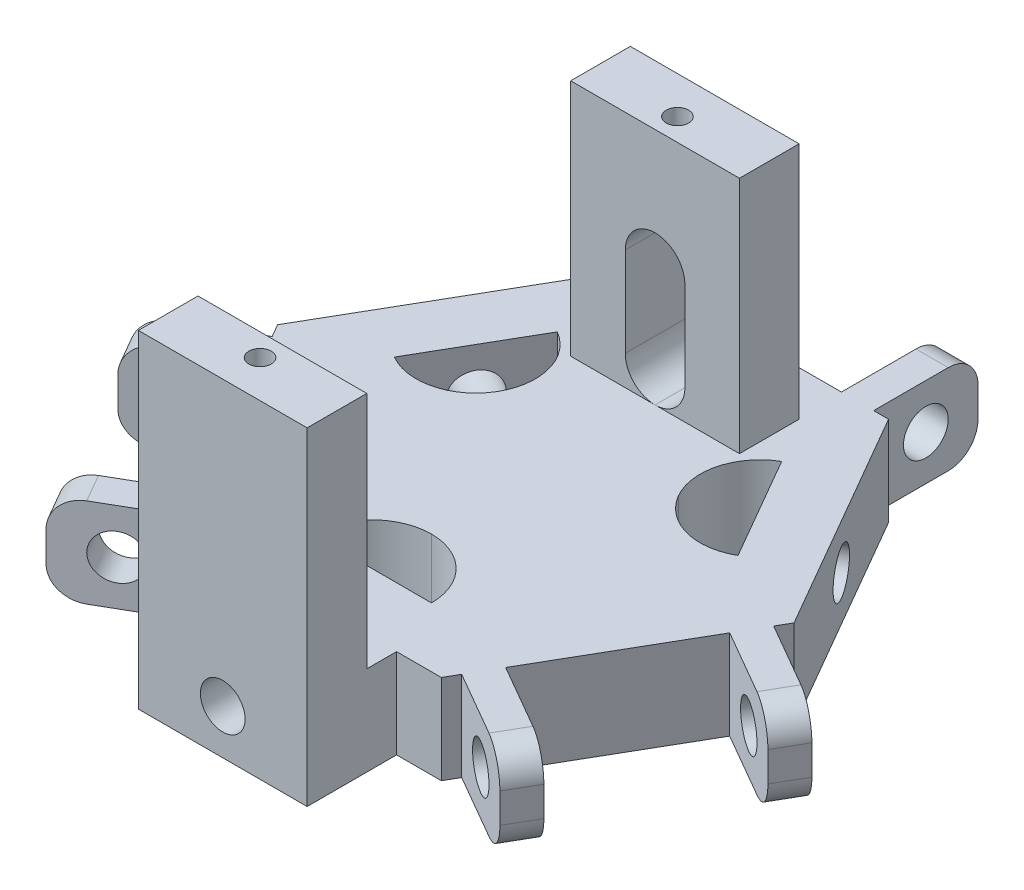
from build123d import *

# Parameters (mm, degrees)
BOSS_EXTRUDE1_DEPTH = 6
SKETCH2_W           = 2.16
SKETCH2_H           = 6
BOSS_EXTRUDE2_DEPTH = 7
SKETCH4_W           = 2.16
SKETCH4_H           = 6
BOSS_EXTRUDE3_DEPTH = 7
SKETCH5_W           = 2.16
SKETCH5_H           = 6
BOSS_EXTRUDE4_DEPTH = 7
SKETCH6_W           = 2.16
SKETCH6_H           = 6
BOSS_EXTRUDE5_DEPTH = 7
SKETCH7_W           = 2.16
SKETCH7_H           = 6
BOSS_EXTRUDE6_DEPTH = 7
SKETCH9_W           = 2.16
SKETCH9_H           = 6
BOSS_EXTRUDE7_DEPTH = 7
SKETCH11_W          = 11.320508076
SKETCH11_H          = 22
BOSS_EXTRUDE8_DEPTH = 6
SKETCH13_W          = 11.320508076
SKETCH13_H          = 2
CUT_EXTRUDE1_DEPTH  = 16
SKETCH14_W          = 11.320508076
SKETCH14_H          = 4
BOSS_EXTRUDE9_DEPTH = 16
SKETCH22_W          = 4
SKETCH22_H          = 10
CUT_EXTRUDE8_DEPTH  = 4
SKETCH23_R          = 1.5
CUT_EXTRUDE9_DEPTH  = 44.598981412
SKETCH24_R          = 1.5
CUT_EXTRUDE10_DEPTH = 45.916354208
SKETCH25_R          = 1.5
CUT_EXTRUDE11_DEPTH = 45.285561147
SKETCH26_W          = 8
SKETCH26_H          = 4
CUT_EXTRUDE12_DEPTH = 6
FILLET1_R           = 4
CUT_EXTRUDE13_DEPTH = 6
FILLET2_R           = 4
CUT_EXTRUDE14_DEPTH = 6
FILLET3_R           = 4
SKETCH34_R          = 1.5
CUT_EXTRUDE15_DEPTH = 4
SKETCH35_R          = 1.5
CUT_EXTRUDE16_DEPTH = 4
SKETCH36_R          = 1.5
CUT_EXTRUDE17_DEPTH = 10
FILLET4_R           = 2
FILLET5_R           = 2
SKETCH37_R          = 0.75
CUT_EXTRUDE19_DEPTH = 5
SKETCH39_R          = 0.75
CUT_EXTRUDE20_DEPTH = 5
FILLET6_R           = 2


with BuildPart() as part:
    # Sketch1 → Boss-Extrude1 (new body)
    with BuildSketch(Plane(origin=(0, 0, 0), x_dir=(1, 0, 0), z_dir=(0, 1, 0))):
        Polygon((17.320508076, 0), (8.660254038, 15), (-8.660254038, 15), (-17.320508076, 0), (-8.660254038, -15), (8.660254038, -15), align=None)
    extrude(amount=BOSS_EXTRUDE1_DEPTH)

    # Sketch2 → Boss-Extrude2 (add)
    with BuildSketch(Plane(origin=(12.990381057, 0, 7.5), x_dir=(0.4999999999999997, 0, -0.8660254037844388), z_dir=(0.8660254037844389, 0, 0.49999999999999983))):
        with Locations((-6.580254038, 3)):
            Rectangle(SKETCH2_W, SKETCH2_H)
    extrude(amount=BOSS_EXTRUDE2_DEPTH)

    # Sketch4 → Boss-Extrude3 (add)
    with BuildSketch(Plane(origin=(12.990381057, 0, 7.5), x_dir=(0.4999999999999997, 0, -0.8660254037844388), z_dir=(0.8660254037844389, 0, 0.49999999999999983))):
        with Locations((6.580254038, 3)):
            Rectangle(SKETCH4_W, SKETCH4_H)
    extrude(amount=BOSS_EXTRUDE3_DEPTH)

    # Sketch5 → Boss-Extrude4 (add)
    with BuildSketch(Plane(origin=(-12.990381057, 0, 7.5), x_dir=(0.4999999999999999, 0, 0.8660254037844387), z_dir=(-0.8660254037844388, 0, 0.49999999999999994))):
        with Locations((-6.580254038, 3)):
            Rectangle(SKETCH5_W, SKETCH5_H)
    extrude(amount=BOSS_EXTRUDE4_DEPTH)

    # Sketch6 → Boss-Extrude5 (add)
    with BuildSketch(Plane(origin=(-12.990381057, 0, 7.5), x_dir=(0.4999999999999999, 0, 0.8660254037844387), z_dir=(-0.8660254037844388, 0, 0.49999999999999994))):
        with Locations((6.580254038, 3)):
            Rectangle(SKETCH6_W, SKETCH6_H)
    extrude(amount=BOSS_EXTRUDE5_DEPTH)

    # Sketch7 → Boss-Extrude6 (add)
    with BuildSketch(Plane(origin=(0, 0, -15), x_dir=(-1, 0, 0), z_dir=(0, 0, -1))):
        with Locations((-6.580254038, 3)):
            Rectangle(SKETCH7_W, SKETCH7_H)
    extrude(amount=BOSS_EXTRUDE6_DEPTH)

    # Sketch9 → Boss-Extrude7 (add)
    with BuildSketch(Plane(origin=(0, 0, -15), x_dir=(-1, 0, 0), z_dir=(0, 0, -1))):
        with Locations((6.580254038, 3)):
            Rectangle(SKETCH9_W, SKETCH9_H)
    extrude(amount=BOSS_EXTRUDE7_DEPTH)

    # Sketch11 → Boss-Extrude8 (add)
    with BuildSketch(Plane.XY.offset(15)):
        with Locations((0, 11)):
            Rectangle(SKETCH11_W, SKETCH11_H)
    extrude(amount=BOSS_EXTRUDE8_DEPTH)

    # Sketch13 → Cut-Extrude1 (cut)
    with BuildSketch(Plane(origin=(0, 22, 0), x_dir=(1, 0, 0), z_dir=(0, 1, 0))):
        with Locations((0, -16)):
            Rectangle(SKETCH13_W, SKETCH13_H)
    extrude(amount=-CUT_EXTRUDE1_DEPTH, mode=Mode.SUBTRACT)

    # Sketch14 → Boss-Extrude9 (add)
    with BuildSketch(Plane(origin=(0, 6, 0), x_dir=(1, 0, 0), z_dir=(0, 1, 0))):
        with Locations((0, 10)):
            Rectangle(SKETCH14_W, SKETCH14_H)
    extrude(amount=BOSS_EXTRUDE9_DEPTH)

    # Sketch22 → Cut-Extrude8 (cut)
    with BuildSketch(Plane(origin=(0, 0, -12), x_dir=(-1, 0, 0), z_dir=(0, 0, -1))):
        with Locations((0.000254038, 11)):
            Rectangle(SKETCH22_W, SKETCH22_H)
    extrude(amount=-CUT_EXTRUDE8_DEPTH, mode=Mode.SUBTRACT)

    # Sketch23 → Cut-Extrude9 (cut, through all)
    with BuildSketch(Plane(origin=(7.660254038, 0, 0), x_dir=(0, 0, -1), z_dir=(1, 0, 0))):
        with Locations(Location((18.5, 3, 0), (0, 0, 90))):
            Circle(SKETCH23_R)
    extrude(amount=-CUT_EXTRUDE9_DEPTH, mode=Mode.SUBTRACT)

    # Sketch24 → Cut-Extrude10 (cut, through all)
    with BuildSketch(Plane(origin=(-3.830127019, 0, 6.633974596), x_dir=(0.8660254037844388, 0, 0.4999999999999997), z_dir=(-0.49999999999999983, 0, 0.8660254037844389))):
        with Locations((18.5, 3)):
            Circle(SKETCH24_R)
    extrude(amount=-CUT_EXTRUDE10_DEPTH, mode=Mode.SUBTRACT)

    # Sketch25 → Cut-Extrude11 (cut, through all)
    with BuildSketch(Plane(origin=(-3.830127019, 0, -6.633974596), x_dir=(-0.8660254037844387, 0, 0.4999999999999999), z_dir=(-0.4999999999999999, 0, -0.8660254037844387))):
        with Locations((18.5, 3)):
            Circle(SKETCH25_R)
    extrude(amount=-CUT_EXTRUDE11_DEPTH, mode=Mode.SUBTRACT)

    # Sketch26 → Cut-Extrude12 (cut)
    with BuildSketch(Plane(origin=(0, 6, 0), x_dir=(1, 0, 0), z_dir=(0, 1, 0))):
        with Locations((-0.000254038, -9)):
            Rectangle(SKETCH26_W, SKETCH26_H)
    extrude(amount=-CUT_EXTRUDE12_DEPTH, mode=Mode.SUBTRACT)

    # Fillet1
    fillet1_edges = [part.edges().sort_by_distance(p)[0] for p in [
        (-4.000254038, 3, 7),
        (3.999745962, 3, 7),
    ]]
    fillet(fillet1_edges, radius=FILLET1_R - 0.0001)  # a hair under: the kernel refuses the full size

    # Sketch32 → Cut-Extrude13 (cut)
    with BuildSketch(Plane(origin=(0, 6, 0), x_dir=(1, 0, 0), z_dir=(0, 1, 0))):
        Polygon((7.526152423, 8.964321618), (4.062050808, 6.964321618), (8.062304845, 0.035678382), (11.526406461, 2.035678382), align=None)
    extrude(amount=-CUT_EXTRUDE13_DEPTH, mode=Mode.SUBTRACT)

    # Fillet2
    fillet2_edges = [part.edges().sort_by_distance(p)[0] for p in [
        (8.062304845, 3, -0.035678382),
        (4.062050808, 3, -6.964321618),
    ]]
    fillet(fillet2_edges, radius=FILLET2_R - 0.0001)  # a hair under: the kernel refuses the full size

    # Sketch33 → Cut-Extrude14 (cut)
    with BuildSketch(Plane(origin=(0, 6, 0), x_dir=(1, 0, 0), z_dir=(0, 1, 0))):
        Polygon((-7.526406461, 8.963881612), (-11.526406461, 2.035678382), (-8.062304845, 0.035678382), (-4.062304845, 6.963881612), align=None)
    extrude(amount=-CUT_EXTRUDE14_DEPTH, mode=Mode.SUBTRACT)

    # Fillet3
    fillet3_edges = [part.edges().sort_by_distance(p)[0] for p in [
        (-8.062304845, 3, -0.035678382),
        (-4.062304845, 3, -6.963881612),
    ]]
    fillet(fillet3_edges, radius=FILLET3_R - 0.0001)  # a hair under: the kernel refuses the full size

    # Sketch34 → Cut-Extrude15 (cut)
    with BuildSketch(Plane(origin=(-12.990381057, 0, -7.5), x_dir=(-0.5, 0, 0.8660254037844386), z_dir=(-0.8660254037844387, 0, -0.5000000000000001))):
        with Locations((0, 3)):
            Circle(SKETCH34_R)
    extrude(amount=-CUT_EXTRUDE15_DEPTH, mode=Mode.SUBTRACT)

    # Sketch35 → Cut-Extrude16 (cut)
    with BuildSketch(Plane(origin=(12.990381057, 0, -7.5), x_dir=(-0.5000000000000003, 0, -0.8660254037844386), z_dir=(0.8660254037844385, 0, -0.5000000000000002))):
        with Locations((0, 3)):
            Circle(SKETCH35_R)
    extrude(amount=-CUT_EXTRUDE16_DEPTH, mode=Mode.SUBTRACT)

    # Sketch36 → Cut-Extrude17 (cut)
    with BuildSketch(Plane.XY.offset(21)):
        with Locations((0, 3)):
            Circle(SKETCH36_R)
    extrude(amount=-CUT_EXTRUDE17_DEPTH, mode=Mode.SUBTRACT)

    # Fillet4
    fillet4_edges = [part.edges().sort_by_distance(p)[0] for p in [
        (1.999745962, 16, -10),
        (-2.000254038, 16, -10),
    ]]
    fillet(fillet4_edges, radius=FILLET4_R - 0.0001)  # a hair under: the kernel refuses the full size

    # Fillet5
    fillet5_edges = [part.edges().sort_by_distance(p)[0] for p in [
        (1.999745962, 6, -10),
        (-2.000254038, 6, -10),
    ]]
    fillet(fillet5_edges, radius=FILLET5_R - 0.0001)  # a hair under: the kernel refuses the full size

    # Sketch37 → Cut-Extrude19 (cut)
    with BuildSketch(Plane(origin=(0, 22, 0), x_dir=(1, 0, 0), z_dir=(0, 1, 0))):
        with Locations(Location((0, 9.5, 0), (0, 0, 270))):
            Circle(SKETCH37_R)
    extrude(amount=-CUT_EXTRUDE19_DEPTH, mode=Mode.SUBTRACT)

    # Sketch39 → Cut-Extrude20 (cut)
    with BuildSketch(Plane(origin=(0, 22, 0), x_dir=(1, 0, 0), z_dir=(0, 1, 0))):
        with Locations(Location((0, -18.5, 0), (0, 0, 270))):
            Circle(SKETCH39_R)
    extrude(amount=-CUT_EXTRUDE20_DEPTH, mode=Mode.SUBTRACT)

    # Fillet6
    fillet6_edges = [part.edges().sort_by_distance(p)[0] for p in [
        (15.762431864, 6, 16.69866716),
        (15.762431864, 0, 16.69866716),
        (22.342685902, 0, 5.30133284),
        (22.342685902, 6, 5.30133284),
        (-22.342685902, 0, 5.30133284),
        (-22.342685902, 6, 5.30133284),
        (-15.762431864, 0, 16.69866716),
        (-15.762431864, 6, 16.69866716),
        (6.580254038, 6, -22),
        (6.580254038, 0, -22),
        (-6.580254038, 0, -22),
        (-6.580254038, 6, -22),
    ]]
    fillet(fillet6_edges, radius=FILLET6_R)


solid = part.part
